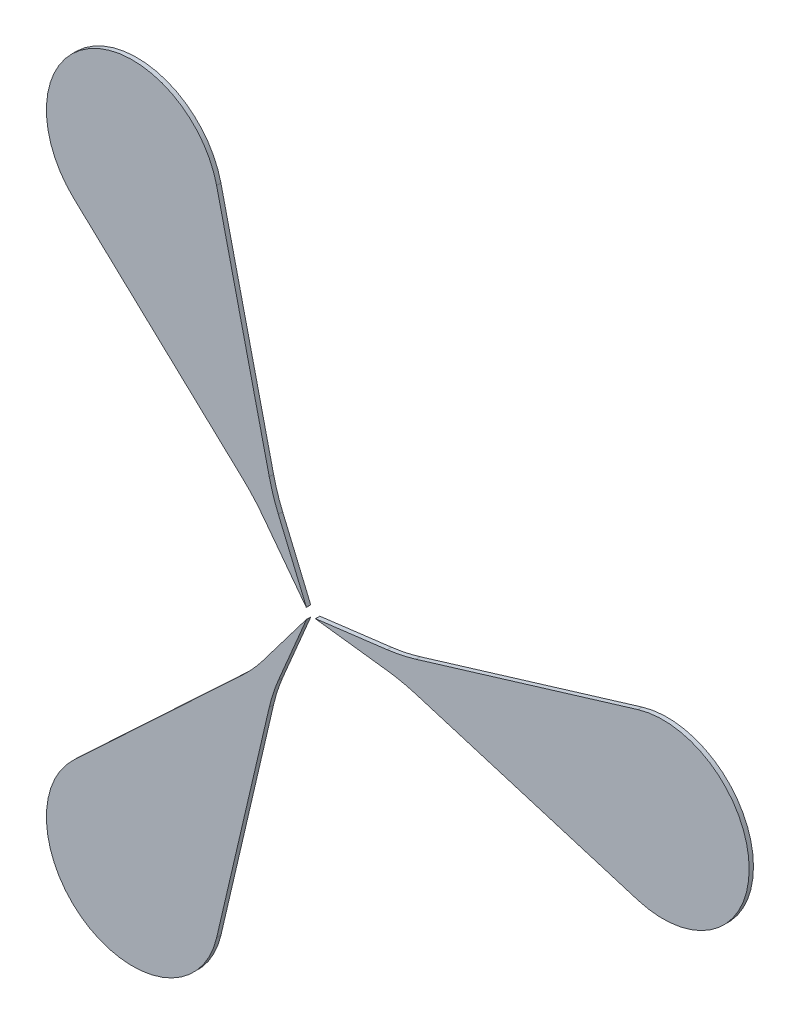
from build123d import *

# Parameters (mm, degrees)
EXTRUDE_2_DEPTH   = 0.25
EXTRUDE_2_2_DEPTH = 0.25
EXTRUDE_2_3_DEPTH = 0.25


with BuildPart() as part:
    # 草圖1 → 填料-伸長2 (new body)
    with BuildSketch(Plane.XY):
        with BuildLine():
            Line((0.357380647, 0.004961492), (4.50941379, 0.523267787))
            ThreePointArc((4.50941379, 0.523267787), (5.349803134, 0.664770922), (6.175092484, 0.877314741))
            Line((6.175092484, 0.877314741), (19.047808057, 4.784468472))
            ThreePointArc((19.047808057, 4.784468472), (25.5, 0), (19.047808057, -4.784468472))
            Line((19.047808057, -4.784468472), (6.175092484, -0.877314741))
            ThreePointArc((6.175092484, -0.877314741), (5.349803134, -0.664770922), (4.50941379, -0.523267787))
            Line((4.50941379, -0.523267787), (0.357380647, -0.004961492))
            ThreePointArc((0.357380647, -0.004961492), (0.353, 0), (0.357380647, 0.004961492))
        make_face()
    extrude(amount=EXTRUDE_2_DEPTH)


with BuildPart() as body_2:
    # 草圖1 → Extrude 2 2 (new body)
    with BuildSketch(Plane.XY):
        with BuildLine():
            Line((-0.182987102, -0.307019973), (-2.707870091, -3.643633005))
            ThreePointArc((-2.707870091, -3.643633005), (-3.250610073, -4.300679958), (-3.847323094, -4.909129591))
            Line((-3.847323094, -4.909129591), (-13.667375269, -14.103651428))
            ThreePointArc((-13.667375269, -14.103651428), (-12.75, -22.083647797), (-5.380432788, -18.8881199))
            Line((-5.380432788, -18.8881199), (-2.327769389, -5.786444332))
            ThreePointArc((-2.327769389, -5.786444332), (-2.09919306, -4.96545088), (-1.801543699, -4.166900792))
            Line((-1.801543699, -4.166900792), (-0.174393546, -0.311981465))
            ThreePointArc((-0.174393546, -0.311981465), (-0.1765, -0.305706968), (-0.182987102, -0.307019973))
        make_face()
    extrude(amount=EXTRUDE_2_2_DEPTH)


with BuildPart() as body_3:
    # 草圖1 → Extrude 2 3 (new body)
    with BuildSketch(Plane.XY):
        with BuildLine():
            Line((-0.174393546, 0.311981465), (-1.801543699, 4.166900792))
            ThreePointArc((-1.801543699, 4.166900792), (-2.09919306, 4.96545088), (-2.327769389, 5.786444332))
            Line((-2.327769389, 5.786444332), (-5.380432788, 18.8881199))
            ThreePointArc((-5.380432788, 18.8881199), (-12.75, 22.083647797), (-13.667375269, 14.103651428))
            Line((-13.667375269, 14.103651428), (-3.847323094, 4.909129591))
            ThreePointArc((-3.847323094, 4.909129591), (-3.250610073, 4.300679958), (-2.707870091, 3.643633005))
            Line((-2.707870091, 3.643633005), (-0.182987102, 0.307019973))
            ThreePointArc((-0.182987102, 0.307019973), (-0.1765, 0.305706968), (-0.174393546, 0.311981465))
        make_face()
    extrude(amount=EXTRUDE_2_3_DEPTH)


solid = Compound([part.part, body_2.part, body_3.part])
